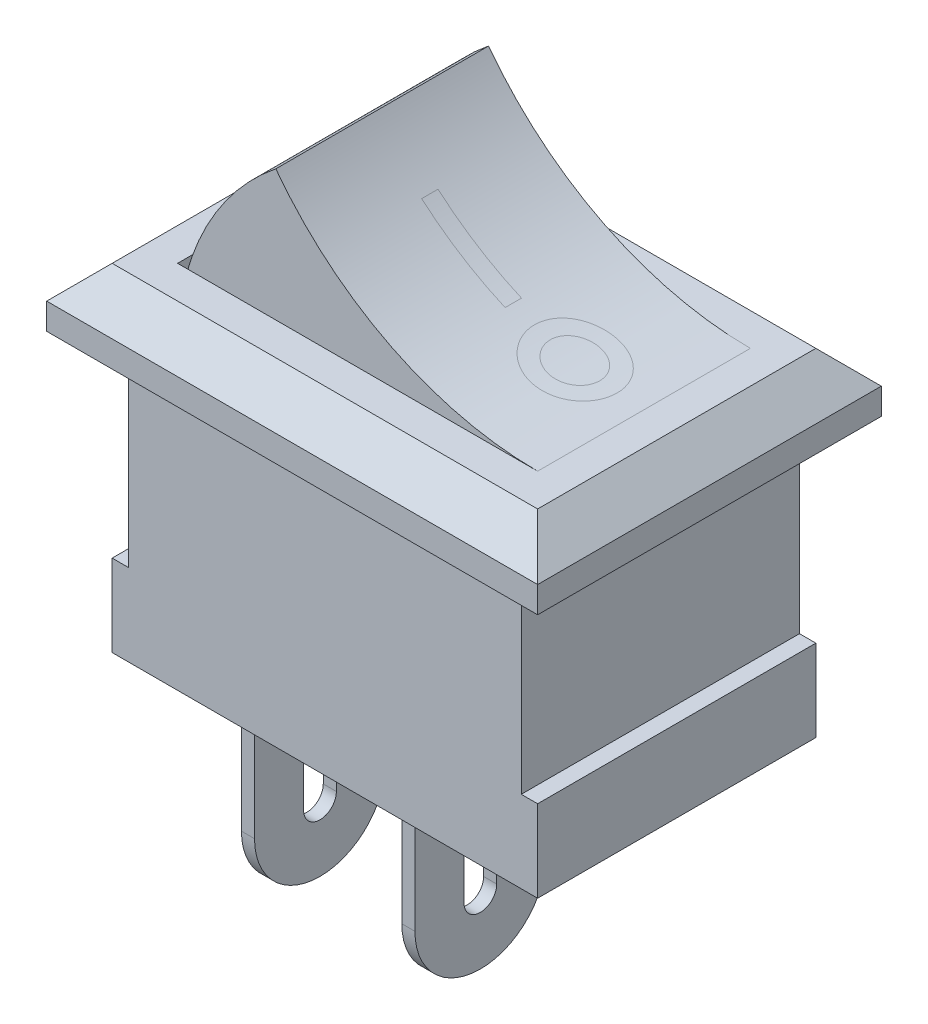
from build123d import *

# Parameters (mm, degrees)
SALIENTE_EXTRUIR1_DEPTH             = 4.25
CROQUIS2_W                          = 15
CROQUIS2_H                          = 10.5
SALIENTE_EXTRUIR2_DEPTH             = 1.8
CROQUIS3_W                          = 11
CROQUIS3_H                          = 6.5
CORTAR_EXTRUIR1_DEPTH               = 1.8
SALIENTE_EXTRUIR3_REACH             = 12.68
SALIENTE_EXTRUIR3_DIRECTION_2_REACH = 12.68
CROQUIS7_W                          = 0.4
CROQUIS7_H                          = 7
SALIENTE_EXTRUIR4_DEPTH             = 2
SALIENTE_EXTRUIR4_2_DEPTH           = 2
REDONDEO1_R                         = 2
REDONDEO2_R                         = 2
CORTAR_EXTRUIR2_DEPTH               = 16.742061491
CHAFL_N1_SIZE                       = 1


with BuildPart() as part:
    # Croquis1 → Saliente-Extruir1 (new, symmetric)
    with BuildSketch(Plane.XY):
        Polygon((6, -3), (6.5, -3), (6.5, -5.5), (-6.5, -5.5), (-6.5, -3), (-6, -3), (-6, 3), (6, 3), align=None)
    extrude(amount=SALIENTE_EXTRUIR1_DEPTH, both=True)

    # Croquis2 → Saliente-Extruir2 (add)
    with BuildSketch(Plane(origin=(0, 3, 0), x_dir=(1, 0, 0), z_dir=(0, 1, 0))):
        Rectangle(CROQUIS2_W, CROQUIS2_H)
    extrude(amount=SALIENTE_EXTRUIR2_DEPTH)

    # Croquis3 → Cortar-Extruir1 (cut)
    with BuildSketch(Plane(origin=(0, 4.8, 0), x_dir=(1, 0, 0), z_dir=(0, 1, 0))):
        Rectangle(CROQUIS3_W, CROQUIS3_H)
    extrude(amount=-CORTAR_EXTRUIR1_DEPTH, mode=Mode.SUBTRACT)


with BuildPart() as body_2:

    # Saliente-Extruir3: up to this face of the body (flat: up to its plane)
    saliente_extruir3_end = Plane(part.part.faces().sort_by_distance((0, 3.9, 3.25))[0])
    # Croquis4 → Saliente-Extruir3 (new, up to the picked face)
    with BuildSketch(Plane.XY, mode=Mode.PRIVATE) as saliente_extruir3_sk1:
        with BuildLine():
            Line((5.5, 3), (-5.5, 3))
            ThreePointArc((-5.5, 3), (-4.618711222, 6.220023046), (-2.5, 8.8))
            ThreePointArc((-2.5, 8.8), (1.027864045, 5.85572809), (5.5, 4.8))
            Line((5.5, 4.8), (5.5, 3))
        make_face()
    saliente_extruir3_tool1 = split(extrude(saliente_extruir3_sk1.sketch, amount=SALIENTE_EXTRUIR3_REACH, mode=Mode.PRIVATE), bisect_by=saliente_extruir3_end, keep=Keep.BOTH, mode=Mode.PRIVATE)
    add(saliente_extruir3_tool1.solids().sort_by(Axis((-0.768886, 4.883197, 0), (0, 0, 1)))[0])


    # Saliente-Extruir3 direction 2: up to this face of the body (flat: up to its plane)
    saliente_extruir3_direction_2_end = Plane(part.part.faces().sort_by_distance((0, 3.9, -3.25))[0])
    # Croquis4 → Saliente-Extruir3 direction 2 (add, up to the picked face)
    with BuildSketch(Plane.XY, mode=Mode.PRIVATE) as saliente_extruir3_direction_2_sk1:
        with BuildLine():
            Line((5.5, 3), (-5.5, 3))
            ThreePointArc((-5.5, 3), (-4.618711222, 6.220023046), (-2.5, 8.8))
            ThreePointArc((-2.5, 8.8), (1.027864045, 5.85572809), (5.5, 4.8))
            Line((5.5, 4.8), (5.5, 3))
        make_face()
    saliente_extruir3_direction_2_tool1 = split(extrude(saliente_extruir3_direction_2_sk1.sketch, amount=-SALIENTE_EXTRUIR3_DIRECTION_2_REACH, mode=Mode.PRIVATE), bisect_by=saliente_extruir3_direction_2_end, keep=Keep.BOTH, mode=Mode.PRIVATE)
    add(saliente_extruir3_direction_2_tool1.solids().sort_by(Axis((-0.768886, 4.883197, 0), (0, 0, -1)))[0])


with BuildPart() as body_3:
    # Croquis7 → Saliente-Extruir4 (new, symmetric)
    with BuildSketch(Plane.XY):
        with Locations((0.3, -9)):
            Rectangle(CROQUIS7_W, CROQUIS7_H)
    extrude(amount=SALIENTE_EXTRUIR4_DEPTH, both=True)

    # Redondeo2
    redondeo2_edges = [body_3.edges().sort_by_distance(p)[0] for p in [
        (0.3, -12.5, -2),
        (0.3, -12.5, 2),
    ]]
    fillet(redondeo2_edges, radius=REDONDEO2_R - 0.0001)  # a hair under: the kernel refuses the full size


with BuildPart() as body_4:
    # Croquis7 → Saliente-Extruir4 2 (new, symmetric)
    with BuildSketch(Plane.XY):
        with Locations((-4.6, -9)):
            Rectangle(CROQUIS7_W, CROQUIS7_H)
    extrude(amount=SALIENTE_EXTRUIR4_2_DEPTH, both=True)

    # Redondeo1
    redondeo1_edges = [body_4.edges().sort_by_distance(p)[0] for p in [
        (-4.6, -12.5, -2),
        (-4.6, -12.5, 2),
    ]]
    fillet(redondeo1_edges, radius=REDONDEO1_R - 0.0001)  # a hair under: the kernel refuses the full size


with BuildPart() as cortar_extruir2_tool:
    # Croquis9 → Cortar-Extruir2 (new, through all)
    with BuildSketch(Plane(origin=(0.5, 0, 0), x_dir=(0, 0, -1), z_dir=(1, 0, 0))):
        with BuildLine():
            Line((-0.5, -10.5), (-0.5, -7.5))
            ThreePointArc((-0.5, -7.5), (0, -7), (0.5, -7.5))
            Line((0.5, -7.5), (0.5, -10.5))
            ThreePointArc((0.5, -10.5), (0, -11), (-0.5, -10.5))
        make_face()
    extrude(amount=-CORTAR_EXTRUIR2_DEPTH)


with BuildPart() as body_3_1:
    add(body_3.part)

    # Cortar-Extruir2: cut by cortar_extruir2_tool
    add(cortar_extruir2_tool.part, mode=Mode.SUBTRACT)


with BuildPart() as body_4_1:
    add(body_4.part)

    # Cortar-Extruir2: cut by cortar_extruir2_tool
    add(cortar_extruir2_tool.part, mode=Mode.SUBTRACT)


with BuildPart() as part_1:
    add(part.part)

    # Chaflán1
    chafl_n1_edges = [part_1.edges().sort_by_distance(p)[0] for p in [
        (7.5, 4.8, 0),
        (0, 4.8, -5.25),
        (-7.5, 4.8, 0),
        (0, 4.8, 5.25),
    ]]
    chamfer(chafl_n1_edges, length=CHAFL_N1_SIZE)


solid = Compound([body_2.part, body_3_1.part, body_4_1.part, part_1.part])
